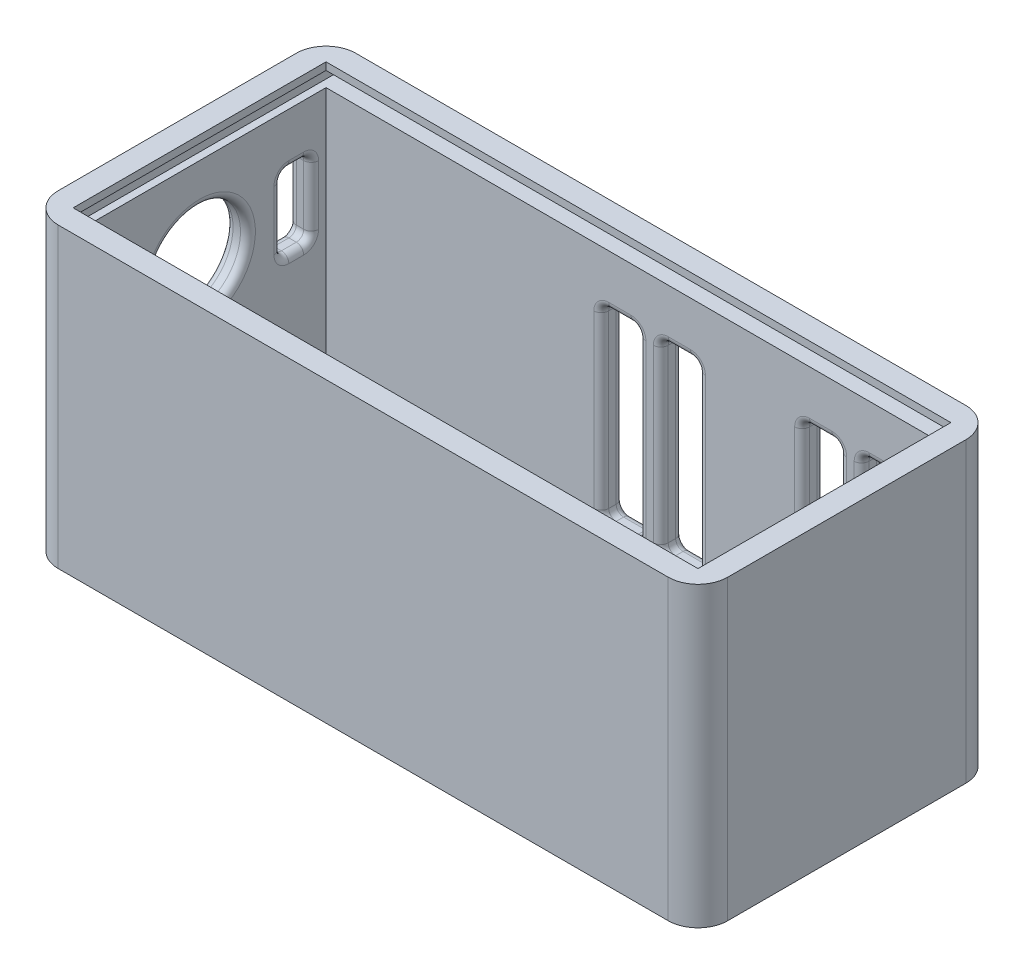
from build123d import *

# Parameters (mm, degrees)
CROQUIS1_W              = 90
CROQUIS1_H              = 40
SALIENTE_EXTRUIR1_DEPTH = 40
CROQUIS2_W              = 84
CROQUIS2_H              = 34
CORTAR_EXTRUIR1_DEPTH   = 38
CROQUIS5_W              = 86
CROQUIS5_H              = 2
CORTAR_EXTRUIR2_DEPTH   = 38
CORTAR_EXTRUIR3_REACH   = 102.499
CROQUIS6_W              = 4
CROQUIS6_H              = 10
CORTAR_EXTRUIR4_REACH   = 74.284
CROQUIS7_W              = 5
CROQUIS7_H              = 25
CROQUIS8_W              = 25
CROQUIS8_H              = 20
CORTAR_EXTRUIR5_DEPTH   = 1
REDONDEO2_R             = 4
REDONDEO5_R             = 1
REDONDEO6_R             = 1
CORTAR_EXTRUIR6_REACH   = 102.499
CROQUIS9_R              = 6.5
REDONDEO7_R             = 1


# Some blends are built 0.0001 mm under size
with BuildPart() as part:
    # Croquis1 → Saliente-Extruir1 (new body)
    with BuildSketch(Plane(origin=(0, 0, 0), x_dir=(1, 0, 0), z_dir=(0, 1, 0))):
        Rectangle(CROQUIS1_W, CROQUIS1_H)
    extrude(amount=SALIENTE_EXTRUIR1_DEPTH)

    # Croquis2 → Cortar-Extruir1 (cut)
    with BuildSketch(Plane(origin=(0, 40, 0), x_dir=(1, 0, 0), z_dir=(0, 1, 0))):
        Rectangle(CROQUIS2_W, CROQUIS2_H)
    extrude(amount=-CORTAR_EXTRUIR1_DEPTH, mode=Mode.SUBTRACT)

    # Croquis5 → Cortar-Extruir2 (cut)
    with BuildSketch(Plane(origin=(0, 0, -20), x_dir=(-1, 0, 0), z_dir=(0, 0, -1))):
        with Locations((0, 38)):
            Rectangle(CROQUIS5_W, CROQUIS5_H)
    extrude(amount=-CORTAR_EXTRUIR2_DEPTH, mode=Mode.SUBTRACT)

    # Croquis6 → Cortar-Extruir3 (cut, up to next)
    with BuildSketch(Plane.ZY.offset(45), mode=Mode.PRIVATE) as cortar_extruir3_sk1:
        with Locations((-13, 25)):
            Rectangle(CROQUIS6_W, CROQUIS6_H)
    cortar_extruir3_tool1 = extrude(cortar_extruir3_sk1.sketch, amount=-CORTAR_EXTRUIR3_REACH, mode=Mode.PRIVATE) & part.part
    add(cortar_extruir3_tool1.solids().sort_by_distance((-45, 25, -13))[0], mode=Mode.SUBTRACT)

    # Croquis7 → Cortar-Extruir4 (cut, up to next)
    with BuildSketch(Plane(origin=(0, 0, -20), x_dir=(-1, 0, 0), z_dir=(0, 0, -1)), mode=Mode.PRIVATE) as cortar_extruir4_sk1:
        with Locations((-32.5, 17.5)):
            Rectangle(CROQUIS7_W, CROQUIS7_H)
    cortar_extruir4_tool1 = extrude(cortar_extruir4_sk1.sketch, amount=-CORTAR_EXTRUIR4_REACH, mode=Mode.PRIVATE) & part.part
    # Croquis7 → Cortar-Extruir4 (cut, up to next)
    with BuildSketch(Plane(origin=(0, 0, -20), x_dir=(-1, 0, 0), z_dir=(0, 0, -1)), mode=Mode.PRIVATE) as cortar_extruir4_sk2:
        with Locations((-24.5, 17.5)):
            Rectangle(CROQUIS7_W, CROQUIS7_H)
    cortar_extruir4_tool2 = extrude(cortar_extruir4_sk2.sketch, amount=-CORTAR_EXTRUIR4_REACH, mode=Mode.PRIVATE) & part.part
    # Croquis7 → Cortar-Extruir4 (cut, up to next)
    with BuildSketch(Plane(origin=(0, 0, -20), x_dir=(-1, 0, 0), z_dir=(0, 0, -1)), mode=Mode.PRIVATE) as cortar_extruir4_sk3:
        with Locations((-5.5, 17.5)):
            Rectangle(CROQUIS7_W, CROQUIS7_H)
    cortar_extruir4_tool3 = extrude(cortar_extruir4_sk3.sketch, amount=-CORTAR_EXTRUIR4_REACH, mode=Mode.PRIVATE) & part.part
    # Croquis7 → Cortar-Extruir4 (cut, up to next)
    with BuildSketch(Plane(origin=(0, 0, -20), x_dir=(-1, 0, 0), z_dir=(0, 0, -1)), mode=Mode.PRIVATE) as cortar_extruir4_sk4:
        with Locations((2.5, 17.5)):
            Rectangle(CROQUIS7_W, CROQUIS7_H)
    cortar_extruir4_tool4 = extrude(cortar_extruir4_sk4.sketch, amount=-CORTAR_EXTRUIR4_REACH, mode=Mode.PRIVATE) & part.part
    add(cortar_extruir4_tool1.solids().sort_by_distance((32.5, 17.5, -20))[0], mode=Mode.SUBTRACT)
    add(cortar_extruir4_tool2.solids().sort_by_distance((24.5, 17.5, -20))[0], mode=Mode.SUBTRACT)
    add(cortar_extruir4_tool3.solids().sort_by_distance((5.5, 17.5, -20))[0], mode=Mode.SUBTRACT)
    add(cortar_extruir4_tool4.solids().sort_by_distance((-2.5, 17.5, -20))[0], mode=Mode.SUBTRACT)

    # Croquis8 → Cortar-Extruir5 (cut)
    with BuildSketch(Plane.ZY.offset(-42)):
        with Locations((0, 18.5)):
            Rectangle(CROQUIS8_W, CROQUIS8_H)
    extrude(amount=-CORTAR_EXTRUIR5_DEPTH, mode=Mode.SUBTRACT)

    # Redondeo2
    # the kernel refuses this fillet: 4 mm, written as the material it takes off along each edge
    with BuildSketch(Plane(origin=(45, -10, 20), x_dir=(-1, 0, 0), z_dir=(0, 1, 0)), Plane(origin=(45, -10, -20), x_dir=(0, 0, 1), z_dir=(0, 1, 0))) as redondeo2_piece_1:
        with BuildLine():
            CenterArc((REDONDEO2_R, -REDONDEO2_R), REDONDEO2_R, 90, 90)
            Line((0, -REDONDEO2_R), (0, 0))
            Line((0, 0), (REDONDEO2_R, 0))
        make_face()
    extrude(amount=60, mode=Mode.SUBTRACT)
    with BuildSketch(Plane(origin=(-45, -10, -20), x_dir=(0, 0, 1), z_dir=(0, 1, 0)), Plane(origin=(-45, -10, 20), x_dir=(1, 0, 0), z_dir=(0, 1, 0))) as redondeo2_piece_2:
        with BuildLine():
            CenterArc((REDONDEO2_R, REDONDEO2_R), REDONDEO2_R, 180, 90)
            Line((0, REDONDEO2_R), (0, 0))
            Line((0, 0), (REDONDEO2_R, 0))
        make_face()
    extrude(amount=60, mode=Mode.SUBTRACT)

    # Redondeo5
    redondeo5_edges = [part.edges().sort_by_distance(p)[0] for p in [
        (3, 17.5, -20),
        (-2.5, 5, -17),
        (0, 17.5, -17),
        (0, 5, -18.5),
        (0, 17.5, -20),
        (-2.5, 30, -17),
        (0, 30, -18.5),
        (-2.5, 30, -20),
        (-5, 17.5, -17),
        (-5, 30, -18.5),
        (-5, 17.5, -20),
        (-5, 5, -18.5),
        (-2.5, 5, -20),
        (30, 17.5, -17),
        (32.5, 5, -17),
        (35, 17.5, -17),
        (30, 5, -18.5),
        (35, 5, -18.5),
        (32.5, 30, -17),
        (35, 30, -18.5),
        (32.5, 30, -20),
        (30, 30, -18.5),
        (32.5, 5, -20),
        (30, 17.5, -20),
        (35, 17.5, -20),
        (22, 17.5, -17),
        (24.5, 5, -17),
        (22, 5, -18.5),
        (27, 17.5, -17),
        (27, 5, -18.5),
        (27, 17.5, -20),
        (24.5, 30, -17),
        (27, 30, -18.5),
        (24.5, 30, -20),
        (22, 30, -18.5),
        (24.5, 5, -20),
        (22, 17.5, -20),
        (3, 17.5, -17),
        (5.5, 5, -17),
        (8, 17.5, -17),
        (8, 5, -18.5),
        (8, 17.5, -20),
        (5.5, 30, -17),
        (8, 30, -18.5),
        (5.5, 30, -20),
        (3, 30, -18.5),
        (3, 5, -18.5),
        (5.5, 5, -20),
    ]]
    fillet(redondeo5_edges, radius=REDONDEO5_R)

    # Redondeo6
    redondeo6_edges = [part.edges().sort_by_distance(p)[0] for p in [
        (-42, 20, -13),
        (-42, 25, -15),
        (-42, 30, -13),
        (-42, 25, -11),
        (-43.5, 20, -15),
        (-43.5, 30, -15),
        (-43.5, 30, -11),
        (-43.5, 20, -11),
        (-45, 25, -15),
        (-45, 20, -13),
        (-45, 25, -11),
        (-45, 30, -13),
    ]]
    fillet(redondeo6_edges, radius=REDONDEO6_R - 0.0001)  # a hair under: the kernel refuses the full size

    # Croquis9 → Cortar-Extruir6 (cut, up to next)
    with BuildSketch(Plane.ZY.offset(45), mode=Mode.PRIVATE) as cortar_extruir6_sk1:
        with Locations((0, 25)):
            Circle(CROQUIS9_R)
    cortar_extruir6_tool1 = extrude(cortar_extruir6_sk1.sketch, amount=-CORTAR_EXTRUIR6_REACH, mode=Mode.PRIVATE) & part.part
    add(cortar_extruir6_tool1.solids().sort_by_distance((-45, 25, 0))[0], mode=Mode.SUBTRACT)

    # Redondeo7
    redondeo7_edges = [part.edges().sort_by_distance(p)[0] for p in [
        (-45, 25, -6.5),
        (-42, 25, -6.5),
    ]]
    fillet(redondeo7_edges, radius=REDONDEO7_R)


solid = part.part
